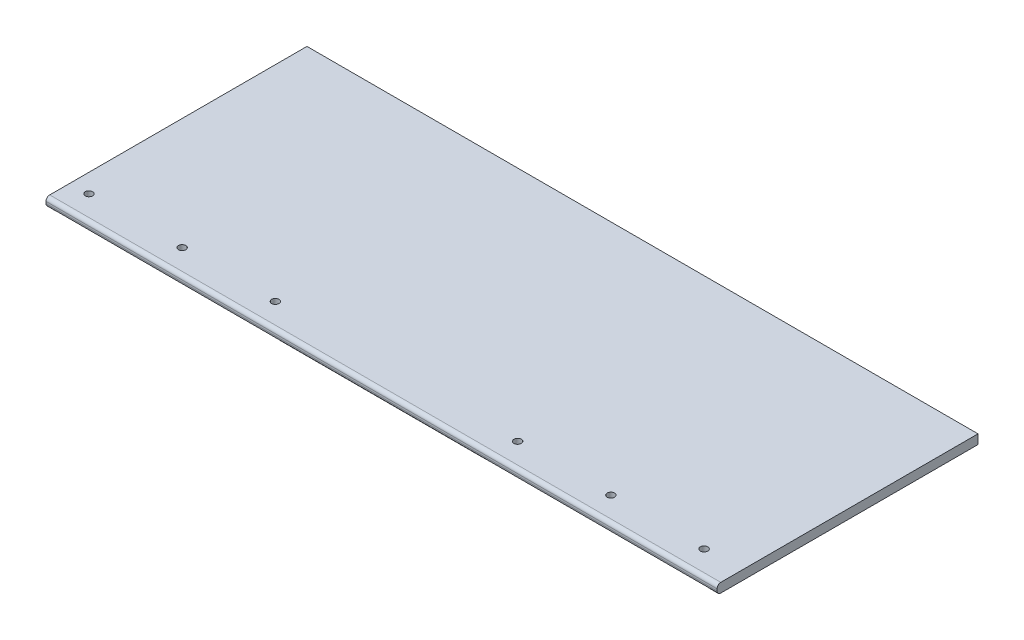
from build123d import *

# Parameters (mm, degrees)
SKETCH1_W           = 457.2
SKETCH1_H           = 177.8
SKETCH1_R           = 2.5019
BOSS_EXTRUDE1_DEPTH = 6.35
FILLET1_R           = 2.54
SKETCH4_R           = 2.54
CUT_EXTRUDE3_DEPTH  = 246.359924397
SKETCH5_W           = 152.4
SKETCH5_H           = 27.7368
CUT_EXTRUDE4_DEPTH  = 1.2192


with BuildPart() as part:
    # Sketch1 → Boss-Extrude1 (new body)
    with BuildSketch(Plane(origin=(0, 0, 0), x_dir=(1, 0, 0), z_dir=(0, 1, 0))):
        Rectangle(SKETCH1_W, SKETCH1_H)
        with Locations((203.2, -72.3392)):
            Circle(SKETCH1_R, mode=Mode.SUBTRACT)
        with Locations((139.7, -72.3392)):
            Circle(SKETCH1_R, mode=Mode.SUBTRACT)
        with Locations((76.2, -72.3392)):
            Circle(SKETCH1_R, mode=Mode.SUBTRACT)
        with Locations((-88.9, -72.3392)):
            Circle(SKETCH1_R, mode=Mode.SUBTRACT)
        with Locations((-152.4, -72.3392)):
            Circle(SKETCH1_R, mode=Mode.SUBTRACT)
        with Locations((-215.9, -72.3392)):
            Circle(SKETCH1_R, mode=Mode.SUBTRACT)
    extrude(amount=BOSS_EXTRUDE1_DEPTH)

    # Fillet1
    fillet1_edges = [part.edges().sort_by_distance(p)[0] for p in [
        (0, 0, 88.9),
        (0, 6.35, 88.9),
    ]]
    fillet(fillet1_edges, radius=FILLET1_R)

    # Sketch4 → Cut-Extrude3 (cut, through all)
    with BuildSketch(Plane.XZ):
        with Locations((203.2, 72.3392)):
            Circle(SKETCH4_R)
    extrude(amount=-CUT_EXTRUDE3_DEPTH, mode=Mode.SUBTRACT)

    # Sketch5 → Cut-Extrude4 (cut)
    with BuildSketch(Plane.XZ):
        with Locations((-146.05, 75.0316)):
            Rectangle(SKETCH5_W, SKETCH5_H)
    cut_extrude4 = extrude(amount=-CUT_EXTRUDE4_DEPTH, mode=Mode.SUBTRACT)

    # Mirror1: Cut-Extrude4 across plane
    add(cut_extrude4.mirror(Plane(origin=(0, 0, 0), x_dir=(0, 0, 1), z_dir=(1, 0, 0))), mode=Mode.SUBTRACT)


solid = part.part
